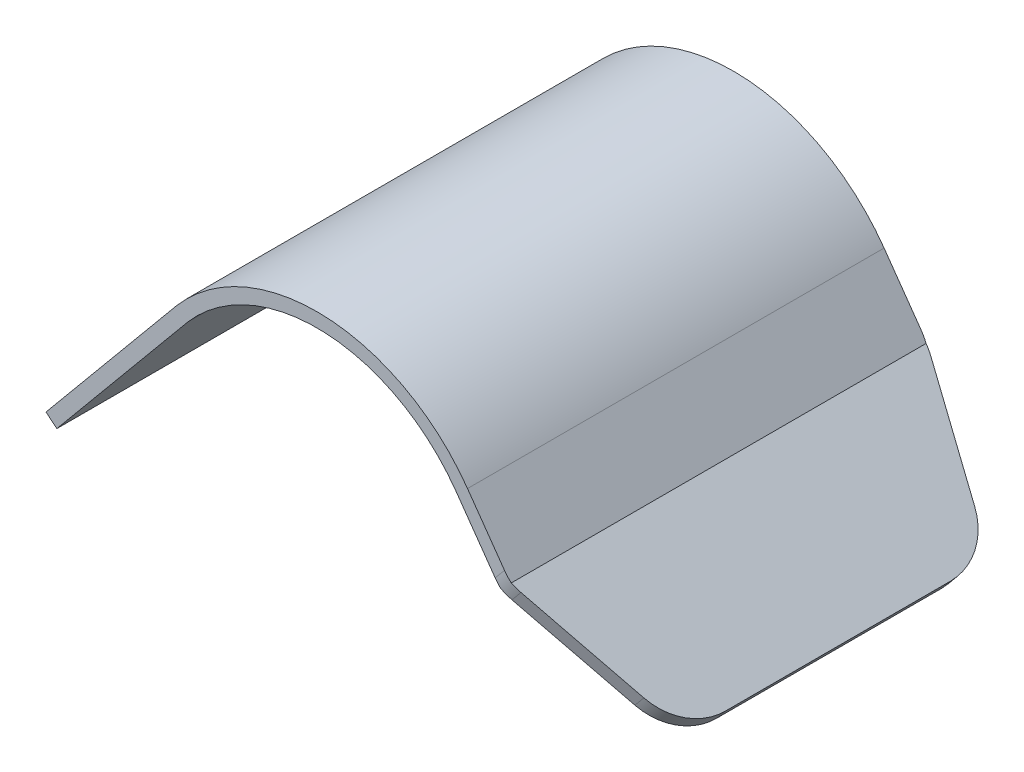
from build123d import *

# Parameters (mm, degrees)
ESTRUSIONE_SOTTILE1_START = -37
ESTRUSIONE_SOTTILE1_DEPTH = 74
SCHIZZO2_R                = 1.7
TAGLIO_ESTRUSIONE2_DEPTH  = 23
TAGLIO_ESTRUSIONE4_DEPTH  = 10
RACCORDO1_R               = 10


# Read off the part's stored shape, not the designer's step: Estrusione-Sottile1
with BuildPart() as part:
    # Estrusione-Sottile1 outline → Estrusione-Sottile1 (new body)
    with BuildSketch(Plane.XY.offset(ESTRUSIONE_SOTTILE1_START)):
        with BuildLine():
            ThreePointArc((75.309556173, 93.111427552), (99.681203079, 103.663061306), (122.974907994, 90.906985924))
            Line((122.974907994, 90.906985924), (130.786083182, 79.848715119))
            Line((130.786083182, 79.848715119), (152.209243946, 62.072969532))
            Line((152.209243946, 62.072969532), (153.805626203, 63.996914357))
            Line((153.805626203, 63.996914357), (132.637123428, 81.561358928))
            Line((132.637123428, 81.561358928), (125.016863249, 92.349351598))
            ThreePointArc((125.016863249, 92.349351598), (99.3221362, 106.178890254), (72.802722922, 94.005318182))
            Line((72.802722922, 94.005318182), (50.135913498, 66.687493457))
            Line((50.135913498, 66.687493457), (52.059858323, 65.0911112))
            Line((52.059858323, 65.0911112), (75.309556173, 93.111427552))
        make_face()
    extrude(amount=ESTRUSIONE_SOTTILE1_DEPTH)

    # Schizzo2 → Taglio-Estrusione2 (cut)
    with BuildSketch(Plane(origin=(-1.154366895, 0.957829354, 0), x_dir=(0, 0, -1), z_dir=(0.76957792998473, -0.6385529028047858, 0))):
        with Locations(Location((-6.552412565, 111.975385882, 0), (0, 0, 90))):
            Circle(SCHIZZO2_R)
        with Locations(Location((-6.552412565, 101.158520834, 0), (0, 0, 90))):
            Circle(SCHIZZO2_R)
        with Locations(Location((1.452296176, 106.816436865, 0), (0, 0, 90))):
            Circle(SCHIZZO2_R)
        with Locations(Location((9.457004918, 101.657487848, 0), (0, 0, 90))):
            Circle(SCHIZZO2_R)
        with Locations(Location((1.553386665, 95.93442008, 0), (0, 0, 90))):
            Circle(SCHIZZO2_R)
        with Locations(Location((9.659185895, 90.710319326, 0), (0, 0, 90))):
            Circle(SCHIZZO2_R)
    extrude(amount=-TAGLIO_ESTRUSIONE2_DEPTH, mode=Mode.SUBTRACT)

    # Schizzo3 → Taglio-Estrusione4 (cut)
    with BuildSketch(Plane(origin=(94.163336629, 113.484764324, 0), x_dir=(0.769577929984725, -0.6385529028047917, 0), z_dir=(0.6385529028047917, 0.769577929984725, 0))):
        Polygon((49.993360387, -37), (77.5, -27), (77.5, -37), align=None)
        Polygon((49.993360387, 37), (77.5, 27), (77.5, 37), align=None)
    extrude(amount=-TAGLIO_ESTRUSIONE4_DEPTH, mode=Mode.SUBTRACT)

    # Raccordo1
    raccordo1_edges = [part.edges().sort_by_distance(p)[0] for p in [
        (131.8389323, 80.599386516, -37),
        (131.8389323, 80.599386516, 37),
        (153.007435074, 63.034941944, -27),
        (153.007435074, 63.034941944, 27),
    ]]
    fillet(raccordo1_edges, radius=RACCORDO1_R)


solid = part.part
